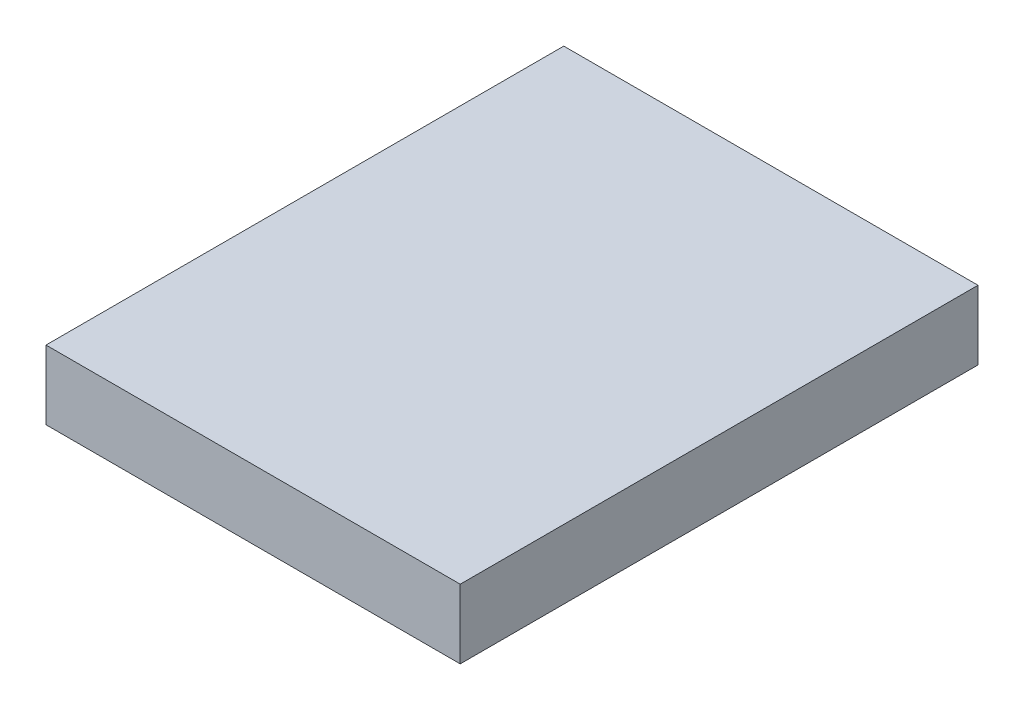
from build123d import *

# Parameters (mm, degrees)
SKETCH1_W           = 229
SKETCH1_H           = 12.7
BOSS_EXTRUDE1_DEPTH = 1
CUT_EXTRUDE3_DEPTH  = 230.354071252


with BuildPart() as part:
    # Sketch1 → Boss-Extrude1 (new body)
    with BuildSketch(Plane(origin=(0, 0, 0), x_dir=(1, 0, 0), z_dir=(0, 1, 0))):
        with Locations((114.5, -6.35)):
            Rectangle(SKETCH1_W, SKETCH1_H)
    extrude(amount=-BOSS_EXTRUDE1_DEPTH)

    # Sketch4 → Cut-Extrude3 (cut, through all)
    with BuildSketch(Plane(origin=(0, 0, 0), x_dir=(1, 0, 0), z_dir=(0, 1, 0))):
        Polygon((229, -12.7), (229, 0), (6, 0), (6, -7.5), (0, -7.5), (0, -12.7), align=None)
    extrude(amount=-CUT_EXTRUDE3_DEPTH, mode=Mode.SUBTRACT)


solid = part.part
